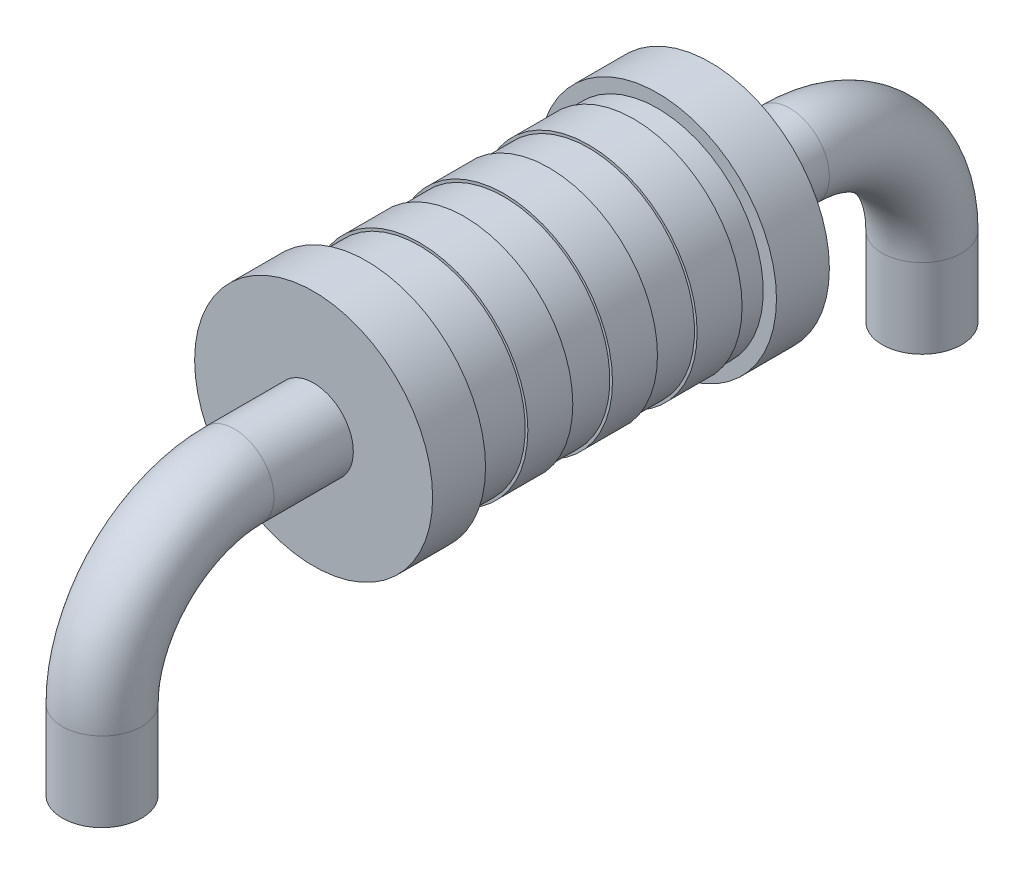
from build123d import *

# Parameters (mm, degrees)
ESBO_O1_R                = 0.4
RESSALTO_EXTRUS_O1_DEPTH = 0.75
VARREDURA1_OUTLINE_R     = 0.15
VARREDURA1_ANGLE         = 90
VARREDURA1_2_OUTLINE_R   = 0.15
VARREDURA1_2_DEPTH       = 1.0500001
VARREDURA1_START         = -0.8
VARREDURA1_3_OUTLINE_R   = 0.15
VARREDURA1_3_DEPTH       = 0.3000001
ESBO_O8_W                = 0.17
ESBO_O8_H                = 0.41
ESBO_O9_W                = 0.17
ESBO_O9_H                = 0.41
ESBO_O10_W               = 0.17
ESBO_O10_H               = 0.41


with BuildPart() as part:
    # Esboço1 → Ressalto-extrusão1 (new, symmetric)
    with BuildSketch(Plane.XY):
        Circle(ESBO_O1_R)
    extrude(amount=RESSALTO_EXTRUS_O1_DEPTH, both=True)



with BuildPart() as body_2:
    # Varredura1: read off the stored shape, not the designer's step
    # Varredura1 outline → Varredura1 (revolve)
    with BuildSketch(Plane(origin=(0, -0.5, 1.05), x_dir=(0, 1, 0), z_dir=(0, 0, -1))):
        with Locations((0.5, 0)):
            Circle(VARREDURA1_OUTLINE_R)
    varredura1 = revolve(axis=Axis((0, -0.5, 1.05), (1, 0, 0)), revolution_arc=VARREDURA1_ANGLE)


with BuildPart() as part_1:
    add(part.part)

    add(body_2.part)  # Varredura1 2 merges body 2
    # Varredura1 2 outline → Varredura1 2 (add)
    with BuildSketch(Plane.XY):
        Circle(VARREDURA1_2_OUTLINE_R)
    varredura1_2 = extrude(amount=VARREDURA1_2_DEPTH)

    # Varredura1 3 outline → Varredura1 3 (add)
    with BuildSketch(Plane(origin=(0, 0, 0), x_dir=(1, 0, 0), z_dir=(0, 1, 0)).offset(VARREDURA1_START)):
        with Locations((0, -1.55)):
            Circle(VARREDURA1_3_OUTLINE_R)
    varredura1_3 = extrude(amount=VARREDURA1_3_DEPTH)

    # Espelhar1: Varredura1, Varredura1 2, Varredura1 3 across plane
    add(varredura1.mirror(Plane.XY))
    add(varredura1_2.mirror(Plane.XY))
    add(varredura1_3.mirror(Plane.XY))

    # Esboço7 → Revolução1 (revolve)
    with BuildSketch(Plane(origin=(0, 0, 0), x_dir=(0, 0, -1), z_dir=(1, 0, 0))):
        Polygon((-0.75, 0), (-0.75, 0.45), (-0.55, 0.45), (-0.55, 0.4), (0.55, 0.4), (0.55, 0.45), (0.75, 0.45), (0.75, 0), align=None)
    revolve(axis=Axis((0, 0, 1.953006301), (0, 0, -1)))

    # Esboço8 → Revolução2 (revolve)
    with BuildSketch(Plane(origin=(0, 0, 0), x_dir=(0, 0, -1), z_dir=(1, 0, 0))):
        with Locations((-0.265, 0.205)):
            Rectangle(ESBO_O8_W, ESBO_O8_H)
    revolve(axis=Axis((0, 0, 1.915551386), (0, 0, -1)))

    # Esboço9 → Revolução3 (revolve)
    with BuildSketch(Plane(origin=(0, 0, 0), x_dir=(0, 0, -1), z_dir=(1, 0, 0))):
        with Locations((0.055, 0.205)):
            Rectangle(ESBO_O9_W, ESBO_O9_H)
    revolve(axis=Axis((0, 0, 1.839950085), (0, 0, -1)))

    # Esboço10 → Revolução4 (revolve)
    with BuildSketch(Plane(origin=(0, 0, 0), x_dir=(0, 0, -1), z_dir=(1, 0, 0))):
        with Locations((0.375, 0.205)):
            Rectangle(ESBO_O10_W, ESBO_O10_H)
    revolve(axis=Axis((0, 0, 1.854283933), (0, 0, -1)))


solid = part_1.part
